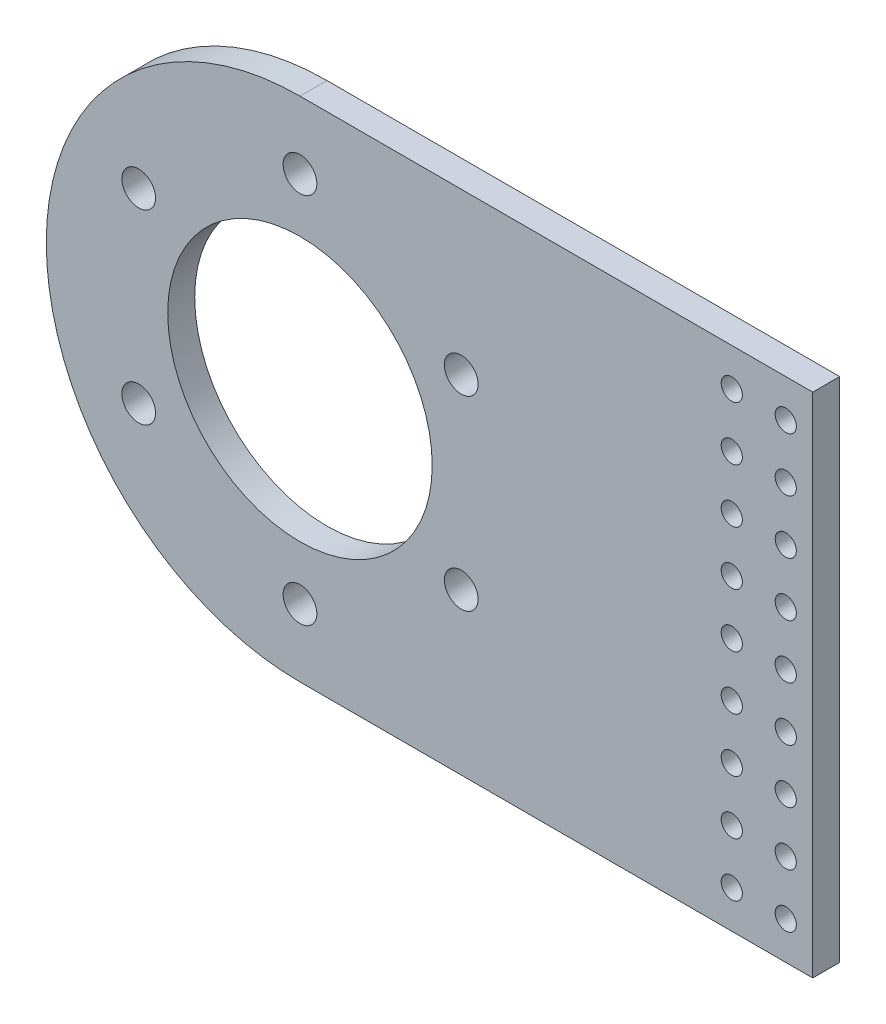
from build123d import *

# Parameters (mm, degrees)
SKETCH1_R                      = 31.115
BOSS_EXTRUDE1_DEPTH            = 6.35
F_9_0_196_DIAMETER_HOLE1_D     = 4.9784
F_5_16_0_3125_DIAMETER_HOLE1_D = 7.9375


with BuildPart() as part:
    # Sketch1 → Boss-Extrude1 (new body)
    with BuildSketch(Plane(origin=(0, 0, 0), x_dir=(0, 1, 0), z_dir=(0, 0, 1))):
        with BuildLine():
            Line((-59.69, 0), (-59.69, -120.65))
            Line((-59.69, -120.65), (59.69, -120.65))
            Line((59.69, -120.65), (59.69, 0))
            ThreePointArc((59.69, 0), (0, 59.69), (-59.69, 0))
        make_face()
        Circle(SKETCH1_R, mode=Mode.SUBTRACT)
    extrude(amount=BOSS_EXTRUDE1_DEPTH)

    # #9 (0.196) Diameter Hole1 (through all)
    with Locations(Plane.XY.offset(6.35)):
        with Locations((114.3, -50.8), (101.6, -50.8), (101.6, -38.1), (101.6, -25.4), (101.6, -12.7), (101.6, 0), (101.6, 12.7), (101.6, 25.4), (101.6, 38.1), (101.6, 50.8), (114.3, -38.1), (114.3, -25.4), (114.3, -12.7), (114.3, 0), (114.3, 12.7), (114.3, 25.4), (114.3, 38.1), (114.3, 50.8)):
            Hole(F_9_0_196_DIAMETER_HOLE1_D / 2)

    # 5/16 (0.3125) Diameter Hole1 (through all)
    with Locations(Plane.XY.offset(6.35)):
        with Locations((37.944903067, 21.9075), (37.944903067, -21.9075), (0, -43.815), (-37.944903067, -21.9075), (-37.944903067, 21.9075), (0, 43.815)):
            Hole(F_5_16_0_3125_DIAMETER_HOLE1_D / 2)


solid = part.part
